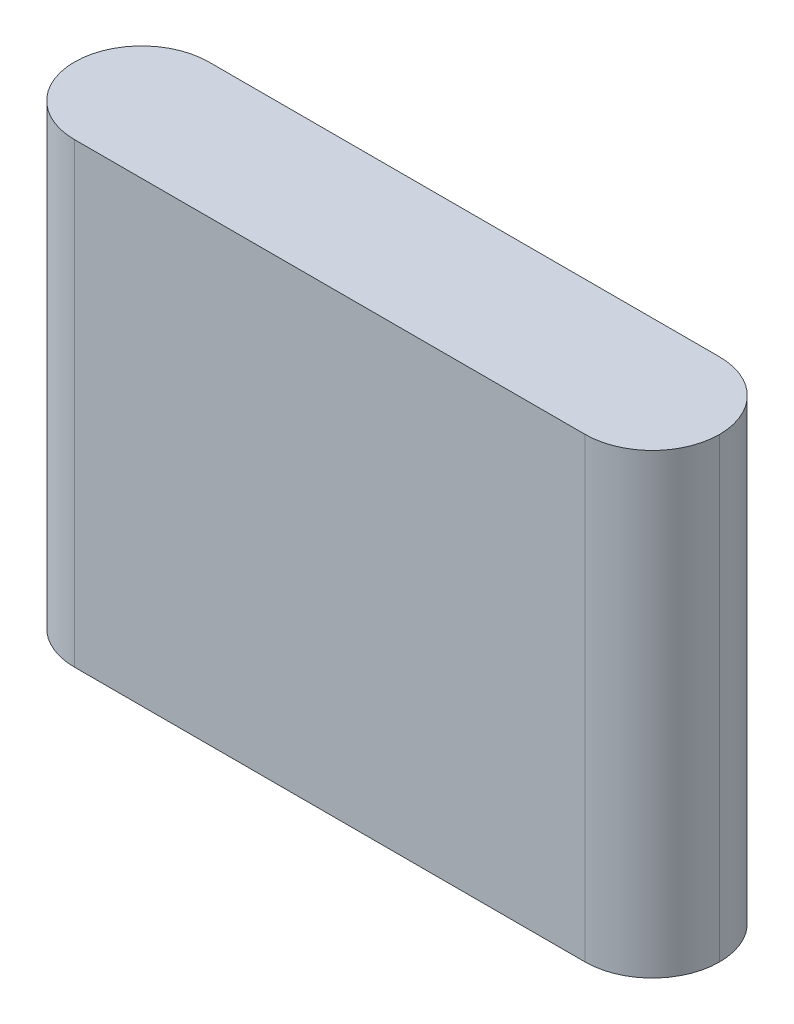
from build123d import *

# Parameters (mm, degrees)
SKETCH1_W           = 72
SKETCH1_H           = 51
BOSS_EXTRUDE1_DEPTH = 15
FILLET2_R           = 7.5
FILLET3_R           = 7.5


with BuildPart() as part:
    # Sketch1 → Boss-Extrude1 (new body)
    with BuildSketch(Plane.XY):
        Rectangle(SKETCH1_W, SKETCH1_H)
    extrude(amount=BOSS_EXTRUDE1_DEPTH)

    # Fillet2
    fillet2_edges = [part.edges().sort_by_distance(p)[0] for p in [
        (36, 0, 15),
    ]]
    fillet(fillet2_edges, radius=FILLET2_R)

    # Fillet3
    fillet3_edges = [part.edges().sort_by_distance(p)[0] for p in [
        (-36, 0, 15),
        (-36, 0, 0),
        (36, 0, 0),
    ]]
    fillet(fillet3_edges, radius=FILLET3_R - 0.0001)  # a hair under: the kernel refuses the full size


solid = part.part
